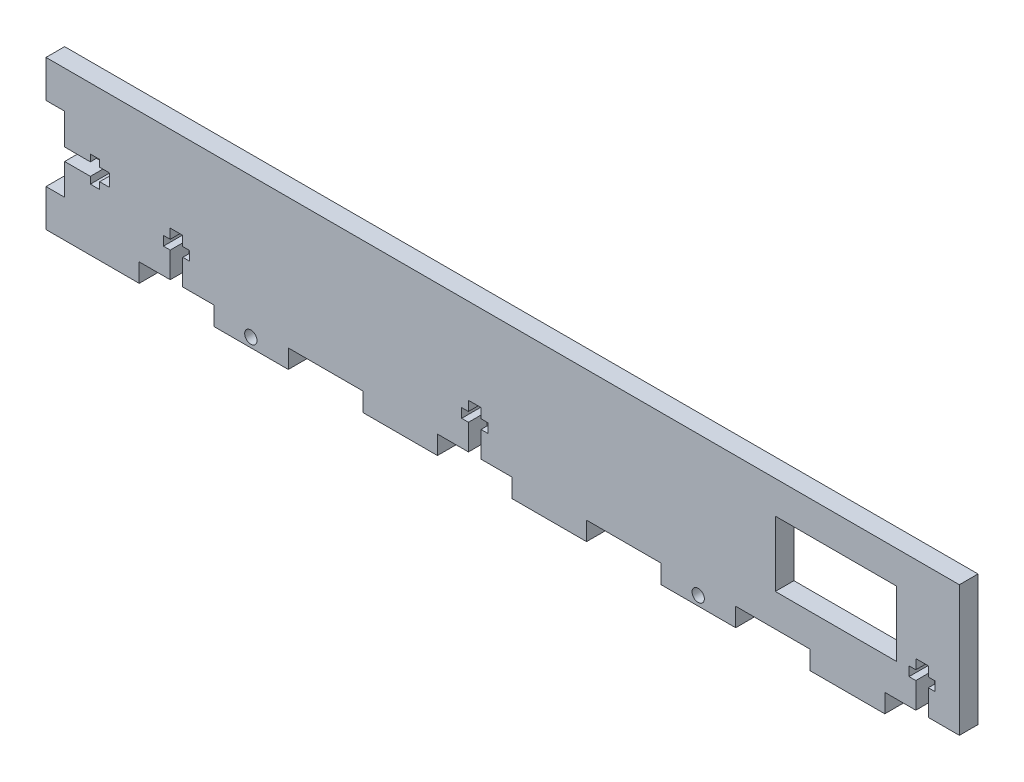
from build123d import *

# Parameters (mm, degrees)
SKETCH1_W           = 304.8
SKETCH1_H           = 44.45
BOSS_EXTRUDE1_DEPTH = 6.35
SKETCH2_W           = 41.275
SKETCH2_H           = 22.225
CUT_EXTRUDE1_DEPTH  = 264.747800776
SKETCH5_W           = 25.4
SKETCH5_H           = 6.35
BOSS_EXTRUDE2_DEPTH = 6.35
LPATTERN1_COUNT     = 6
LPATTERN1_PITCH     = 50.8
SKETCH6_W           = 6.35
SKETCH6_H           = 12.7
BOSS_EXTRUDE3_DEPTH = 6.35
LPATTERN2_COUNT     = 2
LPATTERN2_PITCH     = 38.1
CUT_EXTRUDE2_DEPTH  = 271.670489736
CUT_EXTRUDE3_DEPTH  = 271.670489736
SKETCH9_R           = 2.0955
CUT_EXTRUDE4_DEPTH  = 271.670489736


with BuildPart() as part:
    # Sketch1 → Boss-Extrude1 (new body)
    with BuildSketch(Plane.XY):
        with Locations((-110.333, 0)):
            Rectangle(SKETCH1_W, SKETCH1_H)
    extrude(amount=BOSS_EXTRUDE1_DEPTH)

    # Sketch2 → Cut-Extrude1 (cut, through all)
    with BuildSketch(Plane.XY.offset(6.35)):
        Rectangle(SKETCH2_W, SKETCH2_H)
    extrude(amount=-CUT_EXTRUDE1_DEPTH, mode=Mode.SUBTRACT)

    # Sketch5 → Boss-Extrude2 (add)
    with BuildSketch(Plane.XZ.offset(22.225)):
        with Locations((3.967, 3.175)):
            Rectangle(SKETCH5_W, SKETCH5_H)
    boss_extrude2 = extrude(amount=BOSS_EXTRUDE2_DEPTH)

    # LPattern1: Boss-Extrude2 ×6
    with Locations(*[(-i * LPATTERN1_PITCH, 0, 0) for i in range(1, LPATTERN1_COUNT)]):
        add(boss_extrude2)

    # Sketch6 → Boss-Extrude3 (add)
    with BuildSketch(Plane.ZY.offset(262.733)):
        with Locations((3.175, 15.875)):
            Rectangle(SKETCH6_W, SKETCH6_H)
    boss_extrude3 = extrude(amount=BOSS_EXTRUDE3_DEPTH)

    # LPattern2: Boss-Extrude3 ×2
    with Locations(*[(0, -i * LPATTERN2_PITCH, 0) for i in range(1, LPATTERN2_COUNT)]):
        add(boss_extrude3)

    # Sketch7 → Cut-Extrude2 (cut, through all)
    with BuildSketch(Plane.XY.offset(6.35)):
        Polygon((-262.733, -1.0414), (-262.733, -5.3086), (-253.97, -5.3086), (-253.97, -7.62), (-250.795, -7.62), (-250.795, -5.3086), (-247.493, -5.3086), (-247.493, -1.0414), (-250.795, -1.0414), (-250.795, 1.27), (-253.97, 1.27), (-253.97, -1.0414), align=None)
    extrude(amount=-CUT_EXTRUDE2_DEPTH, mode=Mode.SUBTRACT)

    # Sketch8 → Cut-Extrude3 (cut, through all)
    with BuildSketch(Plane.XY.offset(6.35)):
        Polygon((-226.7666, -22.225), (-222.4994, -22.225), (-222.4994, -13.462), (-220.188, -13.462), (-220.188, -10.287), (-222.4994, -10.287), (-222.4994, -6.985), (-226.7666, -6.985), (-226.7666, -10.287), (-229.078, -10.287), (-229.078, -13.462), (-226.7666, -13.462), align=None)
        Polygon((-125.1666, -22.225), (-120.8994, -22.225), (-120.8994, -13.462), (-118.588, -13.462), (-118.588, -10.287), (-120.8994, -10.287), (-120.8994, -6.985), (-125.1666, -6.985), (-125.1666, -10.287), (-127.478, -10.287), (-127.478, -13.462), (-125.1666, -13.462), align=None)
        Polygon((27.2334, -22.225), (31.5006, -22.225), (31.5006, -13.462), (33.812, -13.462), (33.812, -10.287), (31.5006, -10.287), (31.5006, -6.985), (27.2334, -6.985), (27.2334, -10.287), (24.922, -10.287), (24.922, -13.462), (27.2334, -13.462), align=None)
    extrude(amount=-CUT_EXTRUDE3_DEPTH, mode=Mode.SUBTRACT)

    # Sketch9 → Cut-Extrude4 (cut, through all)
    with BuildSketch(Plane(origin=(0, 0, 0), x_dir=(-1, 0, 0), z_dir=(0, 0, -1))):
        with Locations((46.904309807, -25.4)):
            Circle(SKETCH9_R)
        with Locations((199.304309807, -25.4)):
            Circle(SKETCH9_R)
    extrude(amount=-CUT_EXTRUDE4_DEPTH, mode=Mode.SUBTRACT)


solid = part.part
